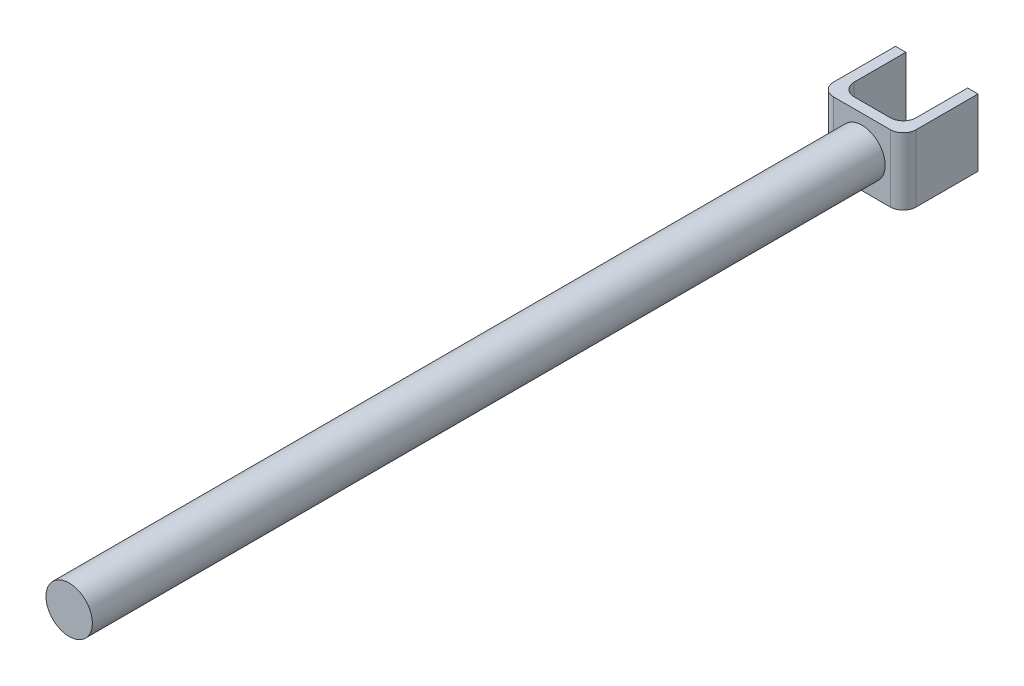
from build123d import *

# Parameters (mm, degrees)
BOSS_EXTRUDE1_DEPTH      = 13
BOSS_EXTRUDE1_DEPTH_BACK = 13
SKETCH2_R                = 9
BOSS_EXTRUDE2_DEPTH      = 307.5


with BuildPart() as part:
    # Sketch1 → Boss-Extrude1 (new, two sides: drawn at the far end of the back side and taken through both)
    with BuildSketch(Plane(origin=(0, 0, 0), x_dir=(1, 0, 0), z_dir=(0, 1, 0)).offset(-BOSS_EXTRUDE1_DEPTH_BACK)):
        with BuildLine():
            Line((7, -20.776256957), (-7, -20.776256957))
            ThreePointArc((-7, -20.776256957), (-10.535533906, -19.311790863), (-12, -15.776256957))
            Line((-12, -15.776256957), (-12, 4.223743043))
            Line((-12, 4.223743043), (-16, 4.223743043))
            Line((-16, 4.223743043), (-16, -19.776256957))
            ThreePointArc((-16, -19.776256957), (-14.535533906, -23.311790863), (-11, -24.776256957))
            Line((-11, -24.776256957), (11, -24.776256957))
            ThreePointArc((11, -24.776256957), (14.535533906, -23.311790863), (16, -19.776256957))
            Line((16, -19.776256957), (16, 4.223743043))
            Line((16, 4.223743043), (12, 4.223743043))
            Line((12, 4.223743043), (12, -15.776256957))
            ThreePointArc((12, -15.776256957), (10.535533906, -19.311790863), (7, -20.776256957))
        make_face()
    extrude(amount=BOSS_EXTRUDE1_DEPTH + BOSS_EXTRUDE1_DEPTH_BACK)

    # Sketch2 → Boss-Extrude2 (add)
    with BuildSketch(Plane.XY.offset(24.776256957)):
        Circle(SKETCH2_R)
    extrude(amount=BOSS_EXTRUDE2_DEPTH)


solid = part.part
